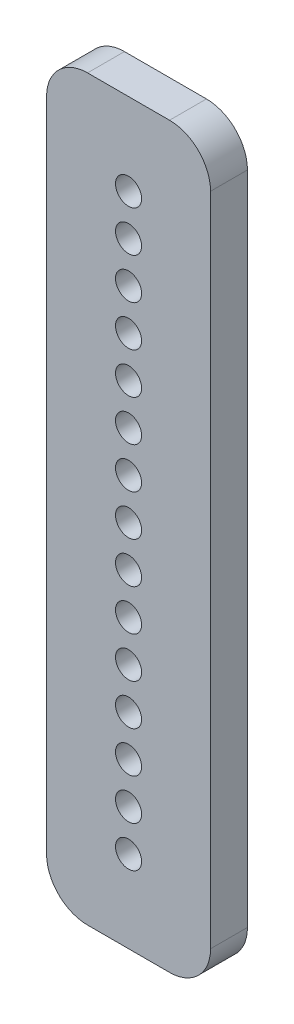
from build123d import *

# Parameters (mm, degrees)
SKETCH1_W           = 25.4
SKETCH1_H           = 114.3
BOSS_EXTRUDE1_DEPTH = 5.715
SKETCH2_R           = 2.0193
CUT_EXTRUDE1_DEPTH  = 5.715
FILLET1_R           = 6.35


with BuildPart() as part:
    # Sketch1 → Boss-Extrude1 (new body)
    with BuildSketch(Plane.XY):
        Rectangle(SKETCH1_W, SKETCH1_H)
    extrude(amount=BOSS_EXTRUDE1_DEPTH)

    # Sketch2 → Cut-Extrude1 (cut)
    with BuildSketch(Plane.XY.offset(5.715)):
        Circle(SKETCH2_R)
        with Locations((0, 6.35)):
            Circle(SKETCH2_R)
        with Locations((0, 12.7)):
            Circle(SKETCH2_R)
        with Locations((0, 19.05)):
            Circle(SKETCH2_R)
        with Locations((0, 25.4)):
            Circle(SKETCH2_R)
        with Locations((0, 31.75)):
            Circle(SKETCH2_R)
        with Locations((0, 38.1)):
            Circle(SKETCH2_R)
        with Locations((0, 44.45)):
            Circle(SKETCH2_R)
        with Locations((0, -6.35)):
            Circle(SKETCH2_R)
        with Locations((0, -12.7)):
            Circle(SKETCH2_R)
        with Locations((0, -19.05)):
            Circle(SKETCH2_R)
        with Locations((0, -25.4)):
            Circle(SKETCH2_R)
        with Locations((0, -31.75)):
            Circle(SKETCH2_R)
        with Locations((0, -38.1)):
            Circle(SKETCH2_R)
        with Locations((0, -44.45)):
            Circle(SKETCH2_R)
    extrude(amount=-CUT_EXTRUDE1_DEPTH, mode=Mode.SUBTRACT)

    # Fillet1
    fillet1_edges = [part.edges().sort_by_distance(p)[0] for p in [
        (12.7, -57.15, 2.8575),
        (-12.7, -57.15, 2.8575),
        (12.7, 57.15, 2.8575),
        (-12.7, 57.15, 2.8575),
    ]]
    fillet(fillet1_edges, radius=FILLET1_R)


solid = part.part
